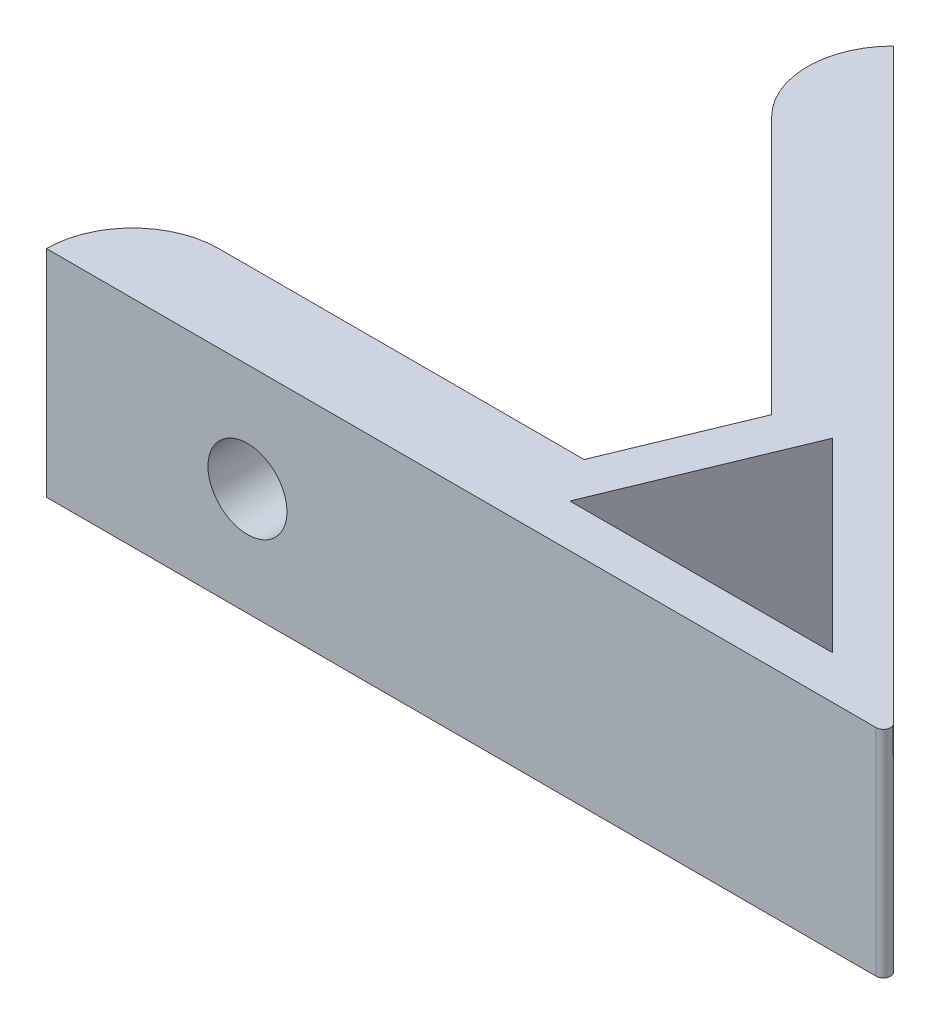
from build123d import *

# Parameters (mm, degrees)
BOSS_EXTRUDE1_DEPTH = 15
FILLET1_R           = 6
FILLET2_R           = 0.5
CUT_EXTRUDE1_DEPTH  = 74.800406503
SKETCH3_R           = 2.75
CUT_EXTRUDE2_DEPTH  = 71.582351894
SKETCH4_R           = 2.75
CUT_EXTRUDE3_DEPTH  = 74.04702868


with BuildPart() as part:
    # Sketch1 → Boss-Extrude1 (new body)
    with BuildSketch(Plane(origin=(0, 0, 0), x_dir=(1, 0, 0), z_dir=(0, 1, 0))):
        Polygon((0, 0), (-59, 0), (-59, 6), (-27.550911023, 6), (-23.724076699, 15.238795325), (-45.961940777, 37.476659403), (-41.71930009, 41.71930009), align=None)
    extrude(amount=BOSS_EXTRUDE1_DEPTH)

    # Fillet1
    fillet1_edges = [part.edges().sort_by_distance(p)[0] for p in [
        (-45.961940777, 7.5, -37.476659403),
        (-59, 7.5, -6),
    ]]
    fillet(fillet1_edges, radius=FILLET1_R - 0.0001)  # a hair under: the kernel refuses the full size

    # Fillet2
    fillet2_edges = [part.edges().sort_by_distance(p)[0] for p in [
        (0, 7.5, 0),
    ]]
    fillet(fillet2_edges, radius=FILLET2_R)

    # Sketch2 → Cut-Extrude1 (cut, through all)
    with BuildSketch(Plane(origin=(0, 15, 0), x_dir=(1, 0, 0), z_dir=(0, 1, 0))):
        Polygon((-20.185335418, 15.942694731), (-7.242640687, 3), (-25.546375109, 3), align=None)
    extrude(amount=-CUT_EXTRUDE1_DEPTH, mode=Mode.SUBTRACT)

    # Sketch3 → Cut-Extrude2 (cut, through all)
    with BuildSketch(Plane(origin=(0, 0, -6), x_dir=(-1, 0, 0), z_dir=(0, 0, -1))):
        with Locations((45, 7.5)):
            Circle(SKETCH3_R)
    extrude(amount=-CUT_EXTRUDE2_DEPTH, mode=Mode.SUBTRACT)

    # Sketch4 → Cut-Extrude3 (cut, through all)
    with BuildSketch(Plane(origin=(-4.242640687, 0, 4.242640687), x_dir=(0.7071067811865465, 0, 0.7071067811865486), z_dir=(-0.7071067811865486, 0, 0.7071067811865465))):
        with Locations((-45, 7.5)):
            Circle(SKETCH4_R)
    extrude(amount=-CUT_EXTRUDE3_DEPTH, mode=Mode.SUBTRACT)


solid = part.part
